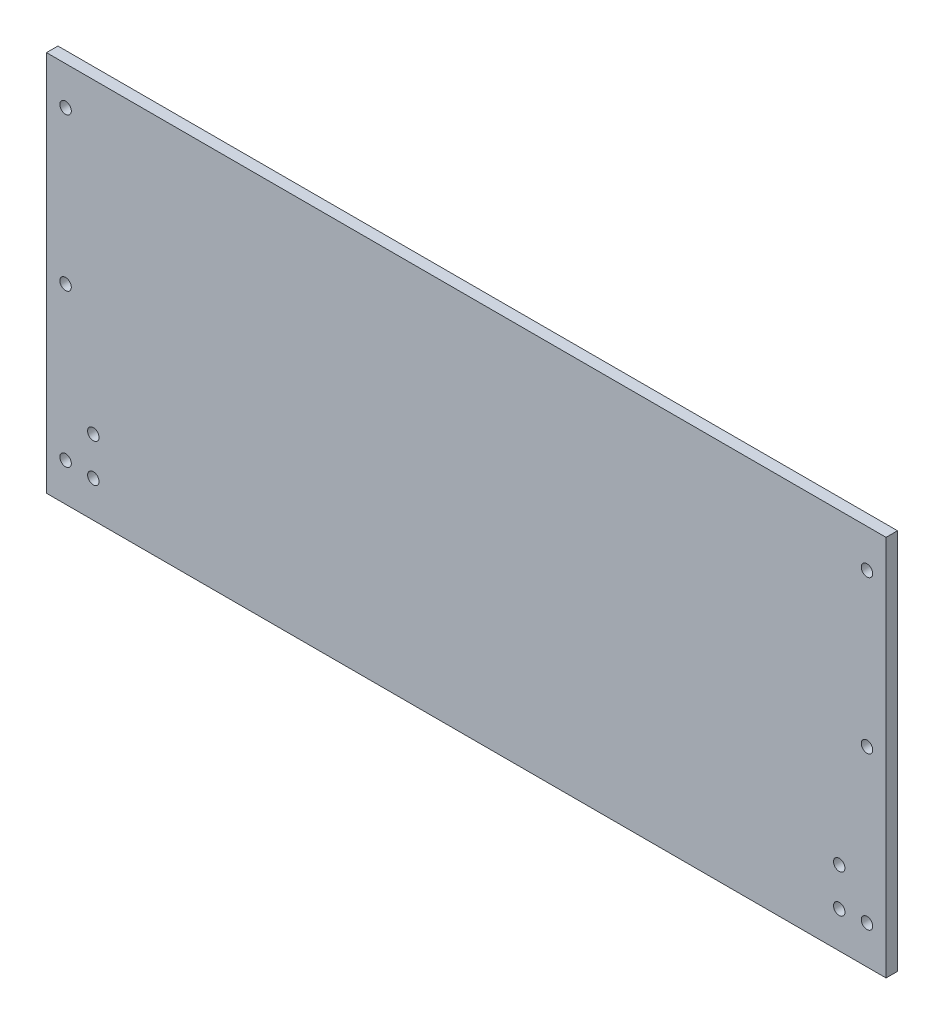
from build123d import *

# Parameters (mm, degrees)
ESQUISSE1_W        = 220
ESQUISSE1_H        = 100
ESQUISSE1_R        = 1.5
BOSS_EXTRU_1_DEPTH = 3


with BuildPart() as part:
    # Esquisse1 → Boss.-Extru.1 (new body)
    with BuildSketch(Plane.XY):
        Rectangle(ESQUISSE1_W, ESQUISSE1_H)
        with Locations((-105, -40)):
            Circle(ESQUISSE1_R, mode=Mode.SUBTRACT)
        with Locations((-105, 0)):
            Circle(ESQUISSE1_R, mode=Mode.SUBTRACT)
        with Locations((-105, 40)):
            Circle(ESQUISSE1_R, mode=Mode.SUBTRACT)
        with Locations((105, 40)):
            Circle(ESQUISSE1_R, mode=Mode.SUBTRACT)
        with Locations((105, 0)):
            Circle(ESQUISSE1_R, mode=Mode.SUBTRACT)
        with Locations((105, -40)):
            Circle(ESQUISSE1_R, mode=Mode.SUBTRACT)
        with Locations((-97.728308863, -30.455320997)):
            Circle(ESQUISSE1_R, mode=Mode.SUBTRACT)
        with Locations((-97.728308863, -40.455320997)):
            Circle(ESQUISSE1_R, mode=Mode.SUBTRACT)
        with Locations((97.728308863, -40.455320997)):
            Circle(ESQUISSE1_R, mode=Mode.SUBTRACT)
        with Locations((97.728308863, -30.455320997)):
            Circle(ESQUISSE1_R, mode=Mode.SUBTRACT)
    extrude(amount=BOSS_EXTRU_1_DEPTH)


solid = part.part
